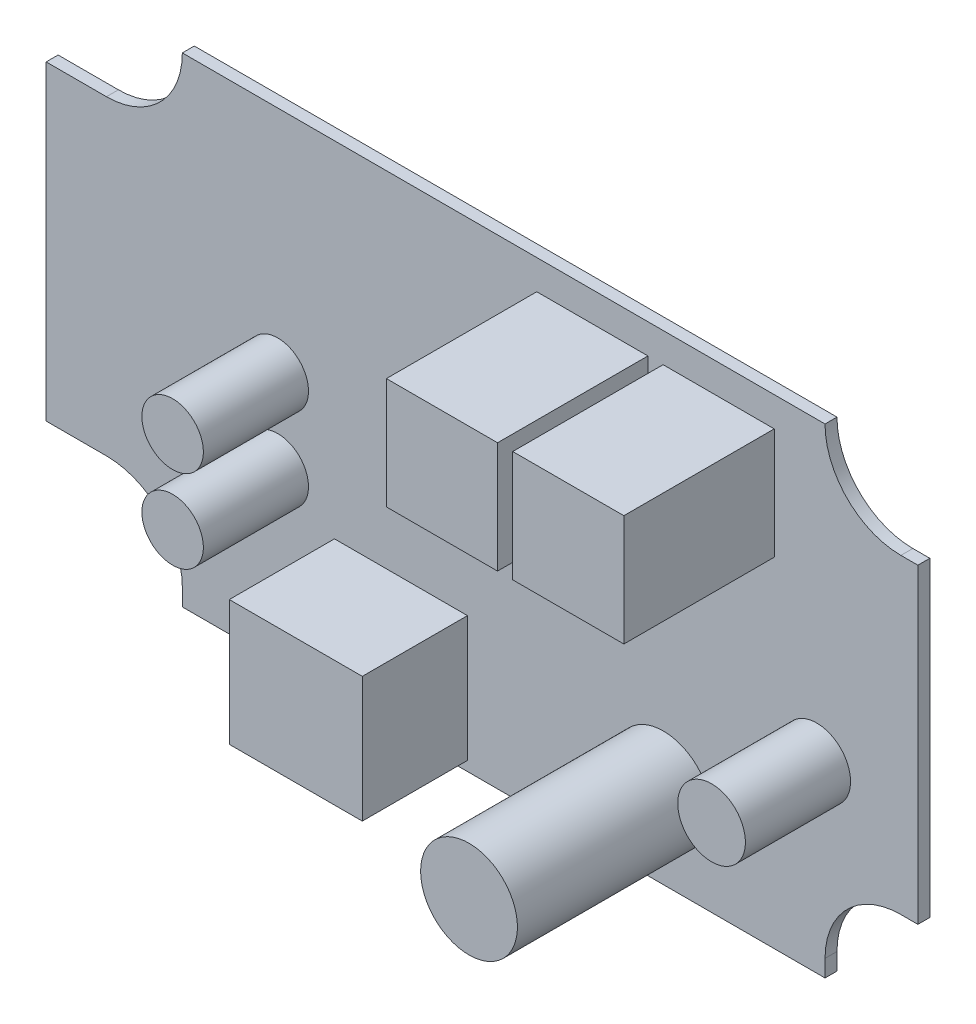
from build123d import *

# Parameters (mm, degrees)
BOSS_EXTRUDE1_DEPTH = 1.5748
SKETCH2_W           = 14.65
SKETCH2_H           = 14.65
BOSS_EXTRUDE2_DEPTH = 19.82
SKETCH3_R           = 6.38
BOSS_EXTRUDE3_DEPTH = 25.62
SKETCH4_R           = 4.05
SKETCH4_R_2         = 4.45846
SKETCH4_W           = 17.528842204
SKETCH4_H           = 16.527194078
BOSS_EXTRUDE4_DEPTH = 13.86


with BuildPart() as part:
    # Sketch1 → Boss-Extrude1 (new body)
    with BuildSketch(Plane.XY):
        with BuildLine():
            Line((42.354093023, -30.703264053), (42.354093023, -32.943264053))
            Line((42.354093023, -32.943264053), (-42.354093023, -32.943264053))
            Line((-42.354093023, -32.943264053), (-42.354093023, -30.703264053))
            ThreePointArc((-42.354093023, -30.703264053), (-45.283025211, -23.632196241), (-52.354093023, -20.703264053))
            Line((-52.354093023, -20.703264053), (-60.301272865, -20.703264053))
            Line((-60.301272865, -20.703264053), (-60.301272865, 20.296735947))
            Line((-60.301272865, 20.296735947), (-52.354093023, 20.296735947))
            ThreePointArc((-52.354093023, 20.296735947), (-45.283025211, 23.225668135), (-42.354093023, 30.296735947))
            Line((-42.354093023, 30.296735947), (42.354093023, 30.296735947))
            ThreePointArc((42.354093023, 30.296735947), (45.283025211, 23.225668135), (52.354093023, 20.296735947))
            Line((52.354093023, 20.296735947), (54.593335979, 20.296735947))
            Line((54.593335979, 20.296735947), (54.593335979, -20.703264053))
            Line((54.593335979, -20.703264053), (52.354093023, -20.703264053))
            ThreePointArc((52.354093023, -20.703264053), (45.283025211, -23.632196241), (42.354093023, -30.703264053))
        make_face()
    extrude(amount=BOSS_EXTRUDE1_DEPTH)

    # Sketch2 → Boss-Extrude2 (add)
    with BuildSketch(Plane.XY.offset(1.5748)):
        with Locations((11.686894588, 19.066351865)):
            Rectangle(SKETCH2_W, SKETCH2_H)
        with Locations((28.336894588, 19.066351865)):
            Rectangle(SKETCH2_W, SKETCH2_H)
    extrude(amount=BOSS_EXTRUDE2_DEPTH)

    # Sketch3 → Boss-Extrude3 (add)
    with BuildSketch(Plane.XY.offset(1.5748)):
        with Locations((21.050882576, -21.779136192)):
            Circle(SKETCH3_R)
    extrude(amount=BOSS_EXTRUDE3_DEPTH)

    # Sketch4 → Boss-Extrude4 (add)
    with BuildSketch(Plane.XY.offset(1.5748)):
        with Locations((-29.775377187, 0)):
            Circle(SKETCH4_R)
        with Locations((-29.775377187, -10.91000664)):
            Circle(SKETCH4_R)
        with Locations((41.26131402, -8.841126254)):
            Circle(SKETCH4_R_2)
        with Locations((-13.538274313, -23.407391016)):
            Rectangle(SKETCH4_W, SKETCH4_H)
    extrude(amount=BOSS_EXTRUDE4_DEPTH)


solid = part.part
